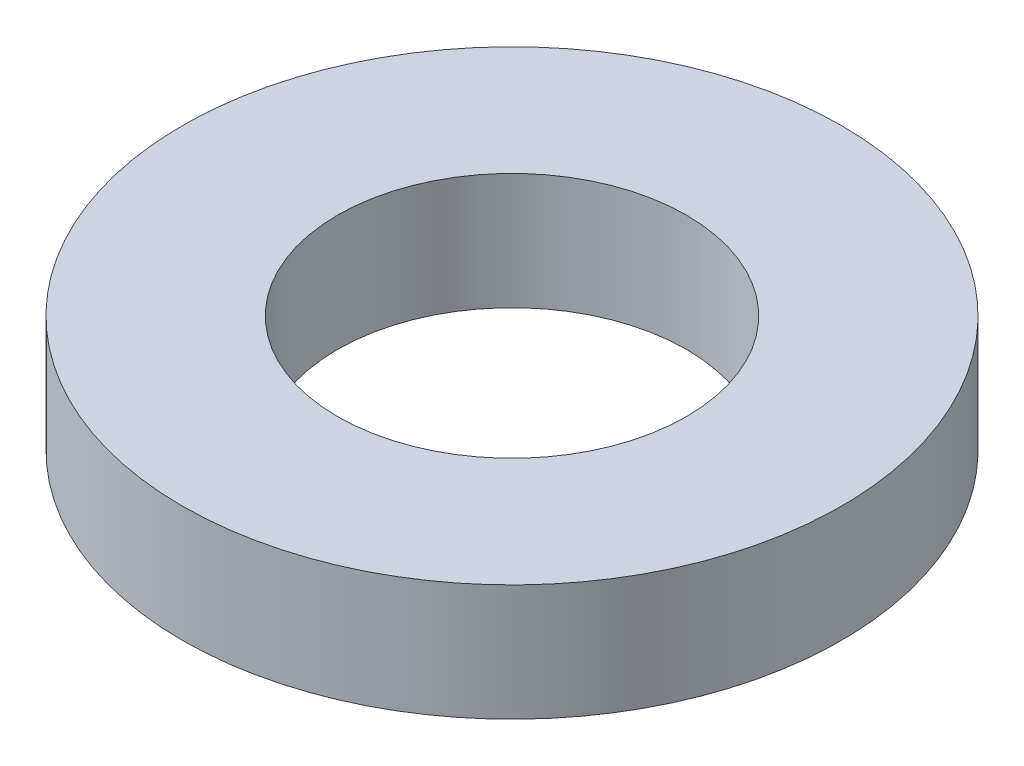
from build123d import *

# Parameters (mm, degrees)
SKETCH1_R           = 85
BOSS_EXTRUDE1_DEPTH = 30
SKETCH2_R           = 45
CUT_EXTRUDE1_DEPTH  = 124.895116934


with BuildPart() as part:
    # Sketch1 → Boss-Extrude1 (new body)
    with BuildSketch(Plane(origin=(0, 0, 0), x_dir=(1, 0, 0), z_dir=(0, 1, 0))):
        Circle(SKETCH1_R)
    extrude(amount=BOSS_EXTRUDE1_DEPTH)

    # Sketch2 → Cut-Extrude1 (cut, through all)
    with BuildSketch(Plane(origin=(0, 0, 0), x_dir=(1, 0, 0), z_dir=(0, 1, 0))):
        Circle(SKETCH2_R)
    extrude(amount=CUT_EXTRUDE1_DEPTH, mode=Mode.SUBTRACT)


solid = part.part
